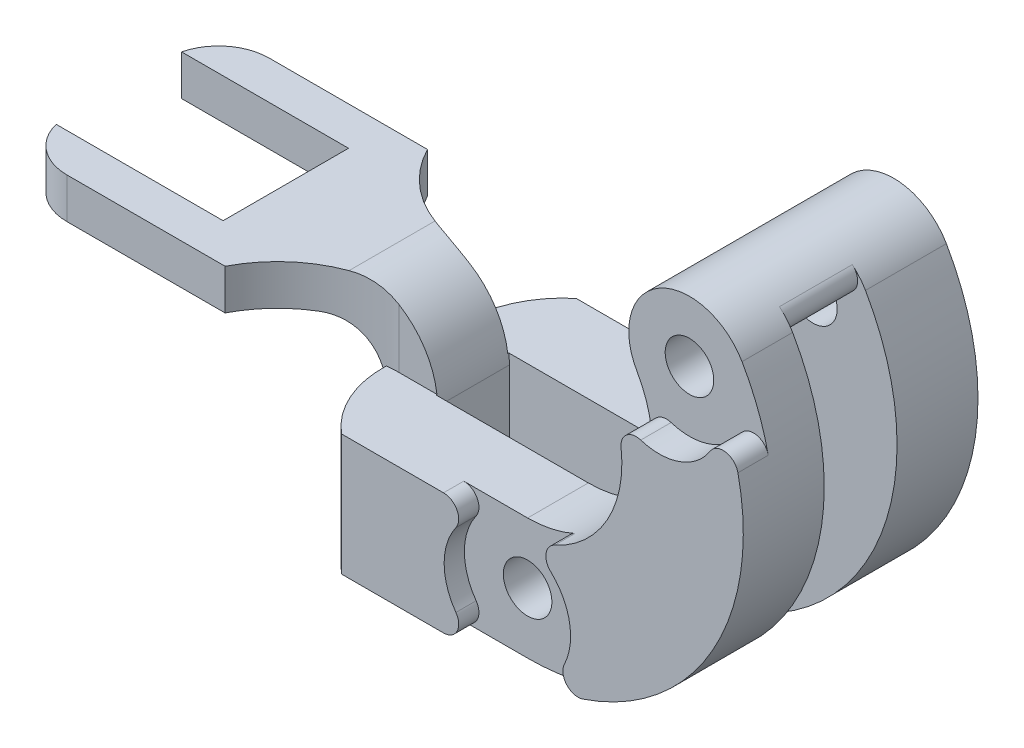
from build123d import *

# Parameters (mm, degrees)
BOSS_EXTRUDE1_DEPTH      = 8
BOSS_EXTRUDE2_DEPTH      = 7.2
BOSS_EXTRUDE3_START      = 15.2
SKETCH1_3_R              = 6
BOSS_EXTRUDE3_DEPTH      = 8
SKETCH3_W                = 5
SKETCH3_H                = 23.2
BOSS_EXTRUDE4_DEPTH      = 12
CUT_EXTRUDE1_START       = -3
SKETCH4_R                = 6
CUT_EXTRUDE1_DEPTH       = 3
FILLET1_START            = 20.2
FILLET1_DEPTH            = 3.8
FILLET1_START_2          = 8
FILLET1_2_DEPTH          = 7.2
SKETCH7_R                = 6.25
CUT_EXTRUDE4_DEPTH       = 2
FILLET2_R                = 1.5
M4_CLEARANCE_HOLE1_D     = 4.8
CUT_EXTRUDE5_DEPTH       = 42.917610932
CUT_EXTRUDE6_START       = -12
CUT_EXTRUDE6_DEPTH       = 8
CUT_EXTRUDE7_DEPTH       = 8
BOSS_EXTRUDE5_DEPTH      = 10
CUT_EXTRUDE9_DEPTH       = 60.718970453
CUT_EXTRUDE9_DEPTH_BACK  = 60.718970453
SKETCH17_W               = 27.826832925
SKETCH17_H               = 12.4
FILLET3_R                = 5
CUT_EXTRUDE10_REACH      = 60.303
CUT_EXTRUDE11_START      = -8
CUT_EXTRUDE11_DEPTH      = 8
FILLET6_R                = 8
CUT_EXTRUDE12_DEPTH      = 61.936360284
CUT_EXTRUDE12_DEPTH_BACK = 61.936360284


with BuildPart() as part:
    # Sketch1 → Boss-Extrude1 (new body)
    with BuildSketch(Plane.XY):
        with BuildLine():
            ThreePointArc((0, -6), (20.196152423, 5.660254038), (20.196152423, 28.980762114))
            ThreePointArc((20.196152423, 28.980762114), (12, 31.176914536), (9.803847577, 22.980762114))
            ThreePointArc((9.803847577, 22.980762114), (9.803847577, 11.660254038), (0, 6))
            Line((0, 6), (-15, 6))
            Line((-15, 6), (-15, -6))
            Line((-15, -6), (0, -6))
        make_face()
    extrude(amount=BOSS_EXTRUDE1_DEPTH)

    # Sketch2 → Boss-Extrude2 (add)
    with BuildSketch(Plane.XY.offset(8)):
        with BuildLine():
            Line((9.803847577, 22.980762114), (20.196152423, 28.980762114))
            ThreePointArc((20.196152423, 28.980762114), (12, 31.176914536), (9.803847577, 22.980762114))
        make_face()
    extrude(amount=BOSS_EXTRUDE2_DEPTH)

    # Sketch1<3> → Boss-Extrude3 (add)
    with BuildSketch(Plane.XY.offset(BOSS_EXTRUDE3_START)):
        with Locations((15, 25.980762114)):
            Circle(SKETCH1_3_R)
        with BuildLine():
            ThreePointArc((9.803847577, 22.980762114), (9.803847577, 11.660254038), (0, 6))
            ThreePointArc((0, 6), (4.242640687, 4.242640687), (6, 0))
            ThreePointArc((6, 0), (4.242640687, -4.242640687), (0, -6))
            ThreePointArc((0, -6), (20.196152423, 5.660254038), (20.196152423, 28.980762114))
            ThreePointArc((20.196152423, 28.980762114), (20.795554958, 27.533676384), (21, 25.980762114))
            ThreePointArc((21, 25.980762114), (16.552914271, 20.185207156), (9.803847577, 22.980762114))
        make_face()
        Circle(SKETCH1_3_R)
        with BuildLine():
            Line((0, 6), (-15, 6))
            Line((-15, 6), (-15, -6))
            Line((-15, -6), (0, -6))
            ThreePointArc((0, -6), (-6, 0), (0, 6))
        make_face()
    extrude(amount=BOSS_EXTRUDE3_DEPTH)

    # Sketch3 → Boss-Extrude4 (add)
    with BuildSketch(Plane(origin=(0, 6, 0), x_dir=(1, 0, 0), z_dir=(0, 1, 0))):
        with Locations((-17.5, -11.6)):
            Rectangle(SKETCH3_W, SKETCH3_H)
    extrude(amount=-BOSS_EXTRUDE4_DEPTH)

    # Sketch4 → Cut-Extrude1 (cut)
    with BuildSketch(Plane.XY.offset(23.2).offset(CUT_EXTRUDE1_START)):
        with Locations((15, 25.980762114)):
            Circle(SKETCH4_R)
    extrude(amount=CUT_EXTRUDE1_DEPTH, mode=Mode.SUBTRACT)

    # Fillet1: read off the stored shape, not the designer's step
    # Fillet1 outline → Fillet1 (cut)
    with BuildSketch(Plane.XY.offset(FILLET1_START)):
        with BuildLine():
            ThreePointArc((22.78988481, 22.266945911), (21.753590077, 25.724519955), (20.196152423, 28.980762114))
            ThreePointArc((20.196152423, 28.980762114), (20.998549002, 25.848815632), (20.059212052, 22.755181017))
            ThreePointArc((20.059212052, 22.755181017), (21.58802328, 23.425369524), (22.78988481, 22.266945911))
        make_face()
        with BuildLine():
            ThreePointArc((13.184858447, 20.261910731), (11.240000131, 21.305037466), (9.803847577, 22.980762114))
            ThreePointArc((9.803847577, 22.980762114), (10.742643673, 20.891153677), (11.24153696, 18.655330111))
            ThreePointArc((11.24153696, 18.655330111), (11.775316706, 19.988281703), (13.184858447, 20.261910731))
        make_face()
    extrude(amount=FILLET1_DEPTH, mode=Mode.SUBTRACT)

    # Fillet1 2 outline → Fillet1 2 (cut)
    with BuildSketch(Plane.XY.offset(FILLET1_START_2)):
        with BuildLine():
            ThreePointArc((20.196152423, 28.980762114), (19.614014408, 29.816237449), (18.898979486, 30.541240046))
            ThreePointArc((18.898979486, 30.541240046), (19.417907488, 29.263492998), (18.674234614, 28.102082457))
            Line((18.674234614, 28.102082457), (20.196152423, 28.980762114))
        make_face()
        with BuildLine():
            ThreePointArc((11.325765386, 23.85944177), (9.948117916, 23.79610744), (9.101020514, 24.884385796))
            ThreePointArc((9.101020514, 24.884385796), (9.37137372, 23.902646091), (9.803847577, 22.980762114))
            Line((9.803847577, 22.980762114), (11.325765386, 23.85944177))
        make_face()
    extrude(amount=FILLET1_2_DEPTH, mode=Mode.SUBTRACT)

    # Sketch7 → Cut-Extrude4 (cut)
    with BuildSketch(Plane.XY.offset(23.2)):
        Circle(SKETCH7_R)
    extrude(amount=-CUT_EXTRUDE4_DEPTH, mode=Mode.SUBTRACT)

    # Fillet2
    fillet2_edges = [part.edges().sort_by_distance(p)[0] for p in [
        (-1.75, 6, 22.2),
        (1.412020937, 6.08840676, 22.2),
        (-1.75, -6, 22.2),
        (2.028685625, -5.91159324, 22.2),
    ]]
    fillet(fillet2_edges, radius=FILLET2_R)

    # M4 Clearance Hole1 (through all)
    with Locations(Plane.XY.offset(23.2)):
        with Locations((0, 0), (15, 25.980762114)):
            Hole(M4_CLEARANCE_HOLE1_D / 2)

    # Sketch8 → Cut-Extrude5 (cut, symmetric)
    with BuildSketch(Plane(origin=(0, 6, 0), x_dir=(1, 0, 0), z_dir=(0, 1, 0))):
        with BuildLine():
            Line((-16.389921041, 0), (-20, 0))
            Line((-20, 0), (-20, -7.692132935))
            ThreePointArc((-20, -7.692132935), (-19.052602124, -3.443557315), (-16.389921041, 0))
        make_face()
    cut_extrude5 = extrude(amount=CUT_EXTRUDE5_DEPTH, both=True, mode=Mode.SUBTRACT)

    # Mirror1: Cut-Extrude5 across plane
    add(cut_extrude5.mirror(Plane.XY.offset(11.6)), mode=Mode.SUBTRACT)

    # Sketch12 → Cut-Extrude6 (cut)
    with BuildSketch(Plane(origin=(0, 6, 0), x_dir=(1, 0, 0), z_dir=(0, 1, 0)).offset(CUT_EXTRUDE6_START)):
        Polygon((-20, -6.6), (-20, -16.6), (-16, -18.909401077), (-16, -4.290598923), align=None)
    extrude(amount=CUT_EXTRUDE6_DEPTH, mode=Mode.SUBTRACT)

    # Sketch13 → Cut-Extrude7 (cut)
    with BuildSketch(Plane.XZ.offset(6)):
        Polygon((-16, 4.290598923), (-19.936057883, 6.563083001), (-19.986057883, 6.476480461), (-15.9, 4.117393842), (-15.9, 19.082606158), (-19.986057883, 16.723519539), (-19.936057883, 16.636916999), (-16, 18.909401077), align=None)
    extrude(amount=-CUT_EXTRUDE7_DEPTH, mode=Mode.SUBTRACT)

    # Sketch14 → Boss-Extrude5 (add, symmetric)
    with BuildSketch(Plane.XY.offset(11.6)):
        with BuildLine():
            Line((-15, 6), (-15, 13))
            Line((-15, 13), (-50, 13))
            Line((-50, 13), (-50, 9))
            Line((-50, 9), (-25, 9))
            ThreePointArc((-25, 9), (-21.464466094, 7.535533906), (-20, 4))
            Line((-20, 4), (-20, 6))
            Line((-20, 6), (-15, 6))
        make_face()
    extrude(amount=BOSS_EXTRUDE5_DEPTH, both=True)

    # Sketch17 → Cut-Extrude9 (cut, two sides: drawn at the far end of the back side and taken through both)
    with BuildSketch(Plane.XZ.offset(-9).offset(-CUT_EXTRUDE9_DEPTH_BACK)):
        with Locations((-47.413416463, 11.6)):
            Rectangle(SKETCH17_W, SKETCH17_H)
    extrude(amount=CUT_EXTRUDE9_DEPTH + CUT_EXTRUDE9_DEPTH_BACK, mode=Mode.SUBTRACT)

    # Fillet3
    # the kernel refuses this fillet: 5 mm, written as the material it takes off along each edge
    with BuildSketch(Plane(origin=(-50, 25.1346611, 21.6), x_dir=(1, 0, 0), z_dir=(0, -1, 0))) as fillet3_piece_1:
        with BuildLine():
            CenterArc((4.85386444, -5), FILLET3_R, 90, 76.113459637)
            Line((0, -3.8), (-0.097077289, -3.776))
            ThreePointArc((-0.097077289, -3.776), (-0.1, -1.9), (-0.1, 0))
            Line((-0.1, 0), (0, 0.1))
            Line((0, 0.1), (4.85386444, 0.1))
            Line((4.85386444, 0.1), (4.85386444, 0))
        make_face()
    extrude(amount=28.269322199, mode=Mode.SUBTRACT)
    with BuildSketch(Plane(origin=(-50, 25.1346611, 1.6), x_dir=(1, 0, 0), z_dir=(0, -1, 0))) as fillet3_piece_2:
        with BuildLine():
            CenterArc((4.85386444, 5), FILLET3_R, 193.886540363, 76.113459637)
            Line((0, 3.8), (-0.097077289, 3.776))
            ThreePointArc((-0.097077289, 3.776), (-0.1, 1.9), (-0.1, 0))
            Line((-0.1, 0), (0, -0.1))
            Line((0, -0.1), (4.85386444, -0.1))
            Line((4.85386444, -0.1), (4.85386444, 0))
        make_face()
    extrude(amount=28.269322199, mode=Mode.SUBTRACT)

    # Cut-Extrude10: up to this face of the body (flat: up to its plane)
    cut_extrude10_end = Plane(part.part.faces().sort_by_distance((-8.271042779, 6, 18.958105224))[0])
    # Sketch18 → Cut-Extrude10 (cut, up to the picked face)
    with BuildSketch(Plane(origin=(0, 13, 0), x_dir=(1, 0, 0), z_dir=(0, 1, 0)), mode=Mode.PRIVATE) as cut_extrude10_sk1:
        with BuildLine():
            Line((-15, -8.1), (-18.834635496, -8.1))
            ThreePointArc((-18.834635496, -8.1), (-25.079633495, -6.346950766), (-29.5, -1.6))
            Line((-29.5, -1.6), (-15, -1.6))
            Line((-15, -1.6), (-15, -8.1))
        make_face()
    cut_extrude10_tool1 = split(extrude(cut_extrude10_sk1.sketch, amount=-CUT_EXTRUDE10_REACH, mode=Mode.PRIVATE), bisect_by=cut_extrude10_end, keep=Keep.BOTH, mode=Mode.PRIVATE)
    # Sketch18 → Cut-Extrude10 (cut, up to the picked face)
    with BuildSketch(Plane(origin=(0, 13, 0), x_dir=(1, 0, 0), z_dir=(0, 1, 0)), mode=Mode.PRIVATE) as cut_extrude10_sk2:
        with BuildLine():
            Line((-15, -15.1), (-18.834635496, -15.1))
            ThreePointArc((-18.834635496, -15.1), (-25.079633495, -16.853049234), (-29.5, -21.6))
            Line((-29.5, -21.6), (-15, -21.6))
            Line((-15, -21.6), (-15, -15.1))
        make_face()
    cut_extrude10_tool2 = split(extrude(cut_extrude10_sk2.sketch, amount=-CUT_EXTRUDE10_REACH, mode=Mode.PRIVATE), bisect_by=cut_extrude10_end, keep=Keep.BOTH, mode=Mode.PRIVATE)
    add(cut_extrude10_tool1.solids().sort_by(Axis((-20.984013, 13, 4.465435), (0, -1, 0)))[0], mode=Mode.SUBTRACT)
    add(cut_extrude10_tool2.solids().sort_by(Axis((-20.984013, 13, 18.734565), (0, -1, 0)))[0], mode=Mode.SUBTRACT)

    # Sketch19 → Cut-Extrude11 (cut)
    with BuildSketch(Plane.XZ.offset(6).offset(CUT_EXTRUDE11_START)):
        with BuildLine():
            Line((-20.014032682, 6.377161665), (-15.8, 3.944188762))
            Line((-15.8, 3.944188762), (-15.8, 19.255811238))
            Line((-15.8, 19.255811238), (-20.014032682, 16.822838335))
            ThreePointArc((-20.014032682, 16.822838335), (-20.078485255, 16.166756248), (-20.1, 15.507867065))
            Line((-20.1, 15.507867065), (-20.1, 7.692132935))
            ThreePointArc((-20.1, 7.692132935), (-20.078485255, 7.033243752), (-20.014032682, 6.377161665))
        make_face()
        with BuildLine():
            Line((-19.921174748, 6.439020166), (-15.9, 4.117393842))
            Line((-15.9, 4.117393842), (-15.9, 19.082606158))
            Line((-15.9, 19.082606158), (-19.921174748, 16.760979834))
            ThreePointArc((-19.921174748, 16.760979834), (-19.980274232, 16.135661823), (-20, 15.507867065))
            Line((-20, 15.507867065), (-20, 7.692132935))
            ThreePointArc((-20, 7.692132935), (-19.980274232, 7.064338177), (-19.921174748, 6.439020166))
        make_face(mode=Mode.SUBTRACT)
    extrude(amount=CUT_EXTRUDE11_DEPTH, mode=Mode.SUBTRACT)

    # Fillet6
    fillet6_edges = [part.edges().sort_by_distance(p)[0] for p in [
        (-15, 13, 11.6),
    ]]
    fillet(fillet6_edges, radius=FILLET6_R)

    # Sketch20 → Cut-Extrude12 (cut, two sides: drawn at the far end of the back side and taken through both)
    with BuildSketch(Plane(origin=(0, 6, 0), x_dir=(1, 0, 0), z_dir=(0, 1, 0)).offset(-CUT_EXTRUDE12_DEPTH_BACK)):
        with BuildLine():
            Line((-16.389921041, 0), (-23, 0))
            Line((-23, 0), (-23, -7.353876601))
            ThreePointArc((-23, -7.353876601), (-21.519167163, -7.795866352), (-19.993811725, -8.043881717))
            ThreePointArc((-19.993811725, -8.043881717), (-19.125934643, -3.603451376), (-16.389921041, 0))
        make_face()
        with BuildLine():
            Line((-23, -23.2), (-23, -15.846123399))
            ThreePointArc((-23, -15.846123399), (-21.519167163, -15.404133648), (-19.993811725, -15.156118283))
            ThreePointArc((-19.993811725, -15.156118283), (-19.125934643, -19.596548624), (-16.389921041, -23.2))
            Line((-16.389921041, -23.2), (-23, -23.2))
        make_face()
    extrude(amount=CUT_EXTRUDE12_DEPTH + CUT_EXTRUDE12_DEPTH_BACK, mode=Mode.SUBTRACT)


solid = part.part
